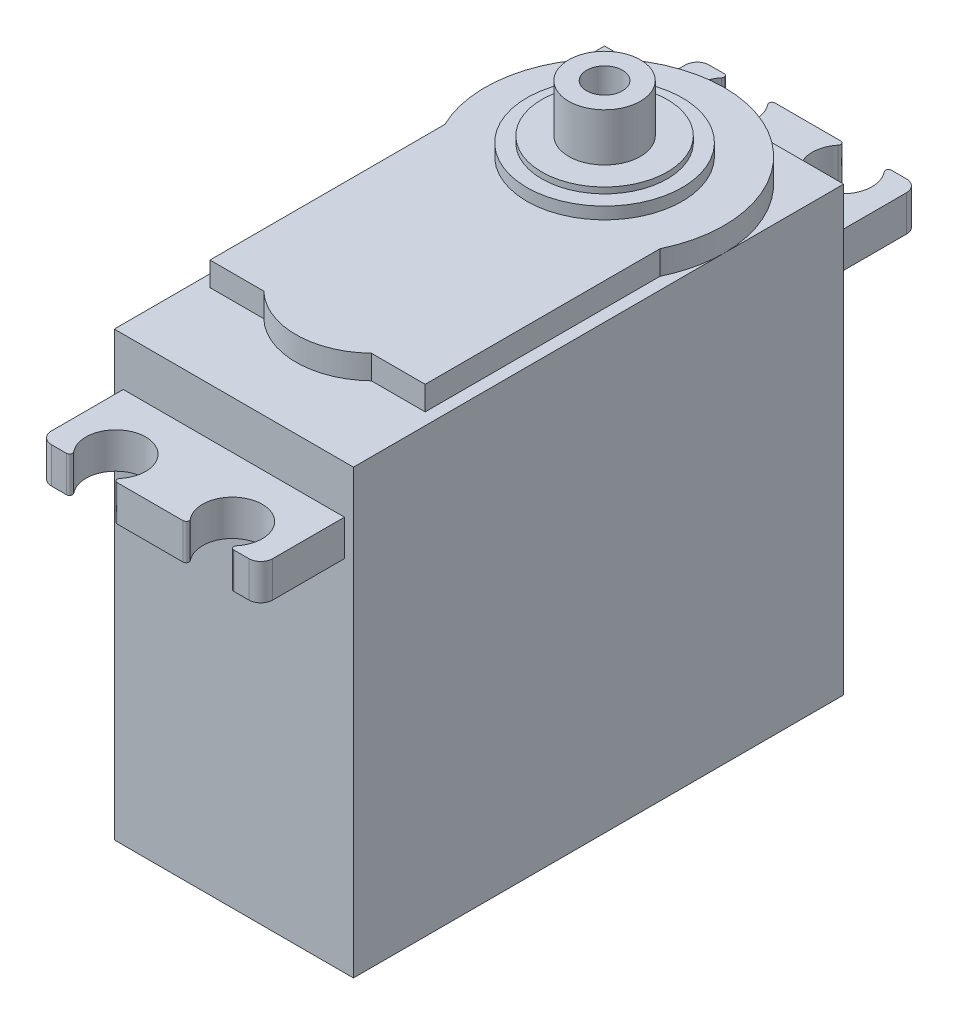
from build123d import *

# Parameters (mm, degrees)
SKETCH1_W           = 20
SKETCH1_H           = 41
BOSS_EXTRUDE1_DEPTH = 37
BOSS_EXTRUDE2_DEPTH = 2
SKETCH3_R           = 6.5
BOSS_EXTRUDE3_DEPTH = 1
SKETCH4_R           = 5.25
BOSS_EXTRUDE4_DEPTH = 0.5
SKETCH5_R           = 3
BOSS_EXTRUDE5_DEPTH = 4
SKETCH6_W           = 3.5
SKETCH6_H           = 4.5
BOSS_EXTRUDE6_DEPTH = 5.5
CUT_EXTRUDE1_DEPTH  = 5
SKETCH8_W           = 9.25
SKETCH8_H           = 3
BOSS_EXTRUDE7_DEPTH = 7
SKETCH9_W           = 18.5
SKETCH9_H           = 3
BOSS_EXTRUDE8_DEPTH = 7
FILLET1_R           = 1
SKETCH10_R          = 2.5
CUT_EXTRUDE2_DEPTH  = 7
SKETCH11_R          = 1.5
CUT_EXTRUDE3_DEPTH  = 20
FILLET2_R           = 0.25
FILLET3_R           = 2


with BuildPart() as part:
    # Sketch1 → Boss-Extrude1 (new body)
    with BuildSketch(Plane(origin=(0, 0, 0), x_dir=(1, 0, 0), z_dir=(0, 1, 0))):
        Rectangle(SKETCH1_W, SKETCH1_H)
    extrude(amount=BOSS_EXTRUDE1_DEPTH)

    # Sketch2 → Boss-Extrude2 (add)
    with BuildSketch(Plane(origin=(0, 37, 0), x_dir=(1, 0, 0), z_dir=(0, 1, 0))):
        with BuildLine():
            Line((-9, 6.141101056), (-9, -13.5))
            Line((-9, -13.5), (-4.5, -13.5))
            ThreePointArc((-4.5, -13.5), (0, -15.30958424), (4.5, -13.5))
            Line((4.5, -13.5), (9, -13.5))
            Line((9, -13.5), (9, 6.141101056))
            ThreePointArc((9, 6.141101056), (0, 20.5), (-9, 6.141101056))
        make_face()
    extrude(amount=BOSS_EXTRUDE2_DEPTH)

    # Sketch3 → Boss-Extrude3 (add)
    with BuildSketch(Plane(origin=(0, 39, 0), x_dir=(1, 0, 0), z_dir=(0, 1, 0))):
        with Locations(Location((0, 10.5, 0), (0, 0, 270))):
            Circle(SKETCH3_R)
    extrude(amount=BOSS_EXTRUDE3_DEPTH)

    # Sketch4 → Boss-Extrude4 (add)
    with BuildSketch(Plane(origin=(0, 40, 0), x_dir=(1, 0, 0), z_dir=(0, 1, 0))):
        with Locations(Location((0, 10.5, 0), (0, 0, 270))):
            Circle(SKETCH4_R)
    extrude(amount=BOSS_EXTRUDE4_DEPTH)

    # Sketch5 → Boss-Extrude5 (add)
    with BuildSketch(Plane(origin=(0, 40.5, 0), x_dir=(1, 0, 0), z_dir=(0, 1, 0))):
        with Locations(Location((0, 10.5, 0), (0, 0, 270))):
            Circle(SKETCH5_R)
    extrude(amount=BOSS_EXTRUDE5_DEPTH)

    # Sketch6 → Boss-Extrude6 (add)
    with BuildSketch(Plane(origin=(0, 0, -20.5), x_dir=(-1, 0, 0), z_dir=(0, 0, -1))):
        with Locations((-1.75, 5.25)):
            Rectangle(SKETCH6_W, SKETCH6_H)
        with Locations((1.75, 5.25)):
            Rectangle(SKETCH6_W, SKETCH6_H)
    extrude(amount=BOSS_EXTRUDE6_DEPTH)

    # Sketch7 → Cut-Extrude1 (cut)
    with BuildSketch(Plane(origin=(0, 0, -26), x_dir=(-1, 0, 0), z_dir=(0, 0, -1))):
        Polygon((3.5, 7.5), (0, 7.5), (0, 7), (2.75, 7), (2.75, 3.5), (0, 3.5), (0, 3), (3.5, 3), align=None)
        Polygon((0, 7), (0, 7.5), (-3.5, 7.5), (-3.5, 3), (0, 3), (0, 3.5), (-2.75, 3.5), (-2.75, 7), align=None)
    extrude(amount=-CUT_EXTRUDE1_DEPTH, mode=Mode.SUBTRACT)

    # Sketch8 → Boss-Extrude7 (add)
    with BuildSketch(Plane.XY.offset(20.5)):
        with Locations((4.625, 31.5)):
            Rectangle(SKETCH8_W, SKETCH8_H)
        with Locations((-4.625, 31.5)):
            Rectangle(SKETCH8_W, SKETCH8_H)
    extrude(amount=BOSS_EXTRUDE7_DEPTH)

    # Sketch9 → Boss-Extrude8 (add)
    with BuildSketch(Plane(origin=(0, 0, -20.5), x_dir=(-1, 0, 0), z_dir=(0, 0, -1))):
        with Locations((0, 31.5)):
            Rectangle(SKETCH9_W, SKETCH9_H)
    extrude(amount=BOSS_EXTRUDE8_DEPTH)

    # Fillet1
    fillet1_edges = [part.edges().sort_by_distance(p)[0] for p in [
        (-9.25, 31.5, -27.5),
        (9.25, 31.5, -27.5),
        (-9.25, 31.5, 27.5),
        (9.25, 31.5, 27.5),
    ]]
    fillet(fillet1_edges, radius=FILLET1_R)

    # Sketch10 → Cut-Extrude2 (cut)
    with BuildSketch(Plane(origin=(0, 33, 0), x_dir=(1, 0, 0), z_dir=(0, 1, 0))):
        with Locations((-4.875, 25.5)):
            Circle(SKETCH10_R)
        with Locations((4.875, 25.5)):
            Circle(SKETCH10_R)
        with Locations((4.875, -25.5)):
            Circle(SKETCH10_R)
        with Locations((-4.875, -25.5)):
            Circle(SKETCH10_R)
    extrude(amount=-CUT_EXTRUDE2_DEPTH, mode=Mode.SUBTRACT)

    # Sketch11 → Cut-Extrude3 (cut)
    with BuildSketch(Plane(origin=(0, 44.5, 0), x_dir=(1, 0, 0), z_dir=(0, 1, 0))):
        with Locations(Location((0, 10.5, 0), (0, 0, 270))):
            Circle(SKETCH11_R)
    extrude(amount=-CUT_EXTRUDE3_DEPTH, mode=Mode.SUBTRACT)

    # Fillet2
    fillet2_edges = [part.edges().sort_by_distance(p)[0] for p in [
        (-3.375, 31.5, -27.5),
        (-6.375, 31.5, -27.5),
        (6.375, 31.5, -27.5),
        (3.375, 31.5, -27.5),
        (3.375, 31.5, 27.5),
        (6.375, 31.5, 27.5),
        (-6.375, 31.5, 27.5),
        (-3.375, 31.5, 27.5),
    ]]
    fillet(fillet2_edges, radius=FILLET2_R)

    # Fillet3
    # the kernel refuses this fillet: 2 mm, written as the material it takes off along each edge
    with BuildSketch(Plane(origin=(2.75, 7, -31), x_dir=(-1, 0, 0), z_dir=(0, 0, 1))) as fillet3_piece_1:
        with BuildLine():
            CenterArc((FILLET3_R, FILLET3_R), FILLET3_R, 180, 90)
            Line((0, FILLET3_R), (0, 0))
            Line((0, 0), (FILLET3_R, 0))
        make_face()
    extrude(amount=10, mode=Mode.SUBTRACT)
    with BuildSketch(Plane(origin=(-2.75, 7, -31), x_dir=(1, 0, 0), z_dir=(0, 0, 1)), Plane(origin=(-2.75, 3.5, -31), x_dir=(0, 1, 0), z_dir=(0, 0, 1)), Plane(origin=(2.75, 3.5, -31), x_dir=(-1, 0, 0), z_dir=(0, 0, 1))) as fillet3_piece_2:
        with BuildLine():
            CenterArc((FILLET3_R, -FILLET3_R), FILLET3_R, 90, 90)
            Line((0, -FILLET3_R), (0, 0))
            Line((0, 0), (FILLET3_R, 0))
        make_face()
    extrude(amount=10, mode=Mode.SUBTRACT)


solid = part.part
